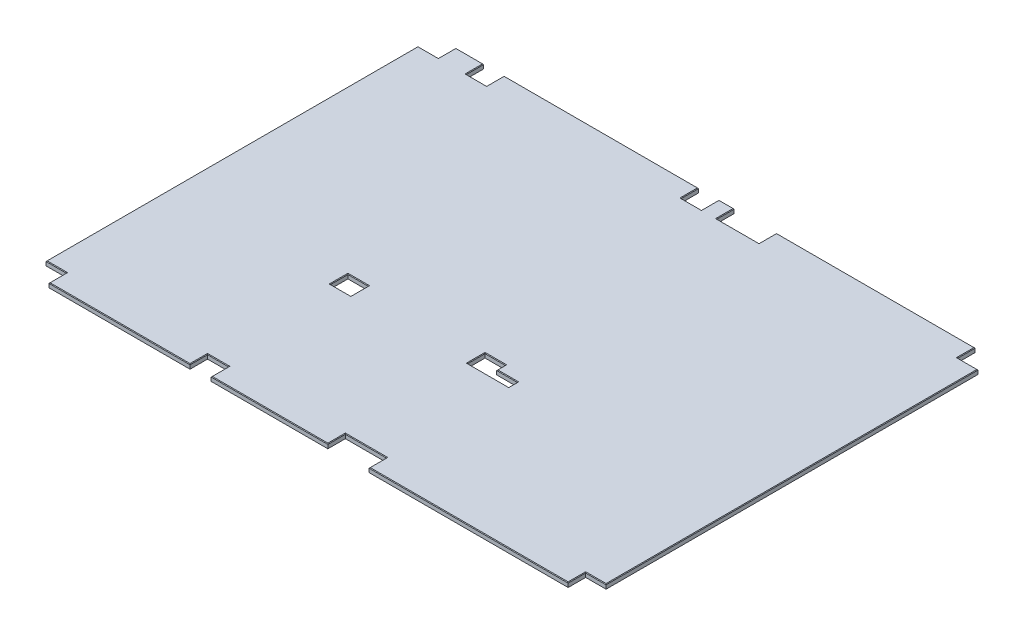
from build123d import *

# Parameters (mm, degrees)
SKETCH1_W                = 2438.4
SKETCH1_H                = 1771.65
BOSS_EXTRUDE1_DEPTH      = 9.525
CUT_EXTRUDE2_START       = 1303.3756
CUT_EXTRUDE2_OUTLINE_W   = 19.05
CUT_EXTRUDE2_OUTLINE_H   = 76.2
CUT_EXTRUDE2_OUTLINE_H_2 = 38.1127
CUT_EXTRUDE2_DEPTH       = 179.3875
CUT_EXTRUDE2_2_OUTLINE_W = 19.05
CUT_EXTRUDE2_2_OUTLINE_H = 76.2
CUT_EXTRUDE2_2_DEPTH     = 88.9
CUT_EXTRUDE2_START_2     = 706.4756
CUT_EXTRUDE2_3_OUTLINE_W = 19.05
CUT_EXTRUDE2_3_OUTLINE_H = 76.2
CUT_EXTRUDE2_3_DEPTH     = 88.9
CUT_EXTRUDE2_START_3     = 2349.5
CUT_EXTRUDE2_4_OUTLINE_W = 19.05
CUT_EXTRUDE2_4_OUTLINE_H = 76.2
CUT_EXTRUDE2_4_DEPTH     = 88.9
CUT_EXTRUDE2_START_4     = 210.1977
CUT_EXTRUDE2_5_OUTLINE_W = 19.05
CUT_EXTRUDE2_5_OUTLINE_H = 76.2
CUT_EXTRUDE2_5_DEPTH     = 88.9
CUT_EXTRUDE2_START_5     = 1145.5273
CUT_EXTRUDE2_6_OUTLINE_W = 19.05
CUT_EXTRUDE2_6_OUTLINE_H = 76.2
CUT_EXTRUDE2_6_DEPTH     = 88.9
CUT_EXTRUDE2_7_OUTLINE_W = 19.05
CUT_EXTRUDE2_7_OUTLINE_H = 38.0873
CUT_EXTRUDE2_7_DEPTH     = 88.991565563
CUT_EXTRUDE2_START_6     = 1300.9118
CUT_EXTRUDE2_8_OUTLINE_W = 19.05
CUT_EXTRUDE2_8_OUTLINE_H = 76.2
CUT_EXTRUDE2_8_DEPTH     = 184.1373
CUT_EXTRUDE2_START_7     = 703.2752
CUT_EXTRUDE2_9_OUTLINE_W = 19.05
CUT_EXTRUDE2_9_OUTLINE_H = 76.2
CUT_EXTRUDE2_9_DEPTH     = 3.2004
CHAMFER1_SIZE            = 2.54


# Read off the part's stored shape, not the designer's step: Cut-Extrude2
with BuildPart() as part:
    # Sketch1 → Boss-Extrude1 (new, symmetric)
    with BuildSketch(Plane(origin=(0, 0, 0), x_dir=(1, 0, 0), z_dir=(0, 1, 0))):
        with Locations((1219.2, 885.825)):
            Rectangle(SKETCH1_W, SKETCH1_H)
    extrude(amount=BOSS_EXTRUDE1_DEPTH, both=True)

    # Cut-Extrude2 outline → Cut-Extrude2 (cut)
    with BuildSketch(Plane.YZ.offset(CUT_EXTRUDE2_START)):
        with Locations((0, -1733.55)):
            Rectangle(CUT_EXTRUDE2_OUTLINE_W, CUT_EXTRUDE2_OUTLINE_H)
        with Locations((0, -627.068849999)):
            Rectangle(CUT_EXTRUDE2_OUTLINE_W, CUT_EXTRUDE2_OUTLINE_H_2)
        with Locations((0, -38.1)):
            Rectangle(CUT_EXTRUDE2_OUTLINE_W, CUT_EXTRUDE2_OUTLINE_H)
    extrude(amount=CUT_EXTRUDE2_DEPTH, mode=Mode.SUBTRACT)

    # Cut-Extrude2 2 outline → Cut-Extrude2 2 (cut)
    with BuildSketch(Plane.YZ):
        with Locations((0, -1733.55)):
            Rectangle(CUT_EXTRUDE2_2_OUTLINE_W, CUT_EXTRUDE2_2_OUTLINE_H)
        with Locations((0, -38.1)):
            Rectangle(CUT_EXTRUDE2_2_OUTLINE_W, CUT_EXTRUDE2_2_OUTLINE_H)
    extrude(amount=CUT_EXTRUDE2_2_DEPTH, mode=Mode.SUBTRACT)

    # Cut-Extrude2 3 outline → Cut-Extrude2 3 (cut)
    with BuildSketch(Plane.YZ.offset(CUT_EXTRUDE2_START_2)):
        with Locations((0, -646.112499999)):
            Rectangle(CUT_EXTRUDE2_3_OUTLINE_W, CUT_EXTRUDE2_3_OUTLINE_H)
        with Locations((0, -38.1)):
            Rectangle(CUT_EXTRUDE2_3_OUTLINE_W, CUT_EXTRUDE2_3_OUTLINE_H)
    extrude(amount=CUT_EXTRUDE2_3_DEPTH, mode=Mode.SUBTRACT)

    # Cut-Extrude2 4 outline → Cut-Extrude2 4 (cut)
    with BuildSketch(Plane.YZ.offset(CUT_EXTRUDE2_START_3)):
        with Locations((0, -1733.55)):
            Rectangle(CUT_EXTRUDE2_4_OUTLINE_W, CUT_EXTRUDE2_4_OUTLINE_H)
        with Locations((0, -38.1)):
            Rectangle(CUT_EXTRUDE2_4_OUTLINE_W, CUT_EXTRUDE2_4_OUTLINE_H)
    extrude(amount=CUT_EXTRUDE2_4_DEPTH, mode=Mode.SUBTRACT)

    # Cut-Extrude2 5 outline → Cut-Extrude2 5 (cut)
    with BuildSketch(Plane.YZ.offset(CUT_EXTRUDE2_START_4)):
        with Locations((0, -1733.55)):
            Rectangle(CUT_EXTRUDE2_5_OUTLINE_W, CUT_EXTRUDE2_5_OUTLINE_H)
    extrude(amount=CUT_EXTRUDE2_5_DEPTH, mode=Mode.SUBTRACT)

    # Cut-Extrude2 6 outline → Cut-Extrude2 6 (cut)
    with BuildSketch(Plane.YZ.offset(CUT_EXTRUDE2_START_5)):
        with Locations((0, -1733.55)):
            Rectangle(CUT_EXTRUDE2_6_OUTLINE_W, CUT_EXTRUDE2_6_OUTLINE_H)
    extrude(amount=CUT_EXTRUDE2_6_DEPTH, mode=Mode.SUBTRACT)

    # Cut-Extrude2 7 outline → Cut-Extrude2 7 (cut)
    with BuildSketch(Plane.YZ.offset(CUT_EXTRUDE2_START)):
        with Locations((0, -665.168849999)):
            Rectangle(CUT_EXTRUDE2_7_OUTLINE_W, CUT_EXTRUDE2_7_OUTLINE_H)
    extrude(amount=CUT_EXTRUDE2_7_DEPTH, mode=Mode.SUBTRACT)

    # Cut-Extrude2 8 outline → Cut-Extrude2 8 (cut)
    with BuildSketch(Plane.YZ.offset(CUT_EXTRUDE2_START_6)):
        with Locations((0, -1733.55)):
            Rectangle(CUT_EXTRUDE2_8_OUTLINE_W, CUT_EXTRUDE2_8_OUTLINE_H)
    extrude(amount=CUT_EXTRUDE2_8_DEPTH, mode=Mode.SUBTRACT)

    # Cut-Extrude2 9 outline → Cut-Extrude2 9 (cut)
    with BuildSketch(Plane.YZ.offset(CUT_EXTRUDE2_START_7)):
        with Locations((0, -38.1)):
            Rectangle(CUT_EXTRUDE2_9_OUTLINE_W, CUT_EXTRUDE2_9_OUTLINE_H)
    extrude(amount=CUT_EXTRUDE2_9_DEPTH, mode=Mode.SUBTRACT)

    # Chamfer1
    chamfer1_edges = [part.edges().sort_by_distance(p)[0] for p in [
        (1300.9118, 9.525, -1733.55),
        (1392.98045, 9.525, -1695.45),
        (1485.0491, 9.525, -1733.55),
        (2349.5, 9.525, -1733.55),
        (2393.95, 9.525, -1695.45),
        (706.4756, 9.525, -646.112499999),
        (750.9256, 9.525, -608.012499999),
        (795.3756, 9.525, -646.112499999),
        (750.9256, 9.525, -684.212499999),
        (2393.95, 9.525, -76.2),
        (2349.5, 9.525, -38.1),
        (1145.5273, 9.525, -1733.55),
        (1189.9773, 9.525, -1695.45),
        (1234.4273, 9.525, -1733.55),
        (44.45, 9.525, -1695.45),
        (88.9, 9.525, -1733.55),
        (0, 9.525, -885.825),
        (396.0876, 9.525, 0),
        (1049.3756, 9.525, 0),
        (1916.13155, 9.525, 0),
        (2438.4, 9.525, -885.825),
        (1917.27455, 9.525, -1771.65),
        (1267.66955, 9.525, -1771.65),
        (722.3125, 9.525, -1771.65),
        (149.54885, 9.525, -1771.65),
        (1303.3756, 9.525, -646.112499999),
        (1393.06935, 9.525, -608.012499999),
        (1482.7631, 9.525, -627.068849999),
        (1437.565132782, 9.525, -646.125199999),
        (1392.367165563, 9.525, -665.168849999),
        (1347.871382781, 9.525, -684.212499999),
        (88.9, 9.525, -38.1),
        (44.45, 9.525, -76.2),
        (795.3756, 9.525, -38.1),
        (749.3254, 9.525, -76.2),
        (703.2752, 9.525, -38.1),
        (1482.7631, 9.525, -38.1),
        (1393.06935, 9.525, -76.2),
        (1303.3756, 9.525, -38.1),
        (210.1977, 9.525, -1733.55),
        (254.6477, 9.525, -1695.45),
        (299.0977, 9.525, -1733.55),
    ]]
    chamfer(chamfer1_edges, length=CHAMFER1_SIZE)


solid = part.part
